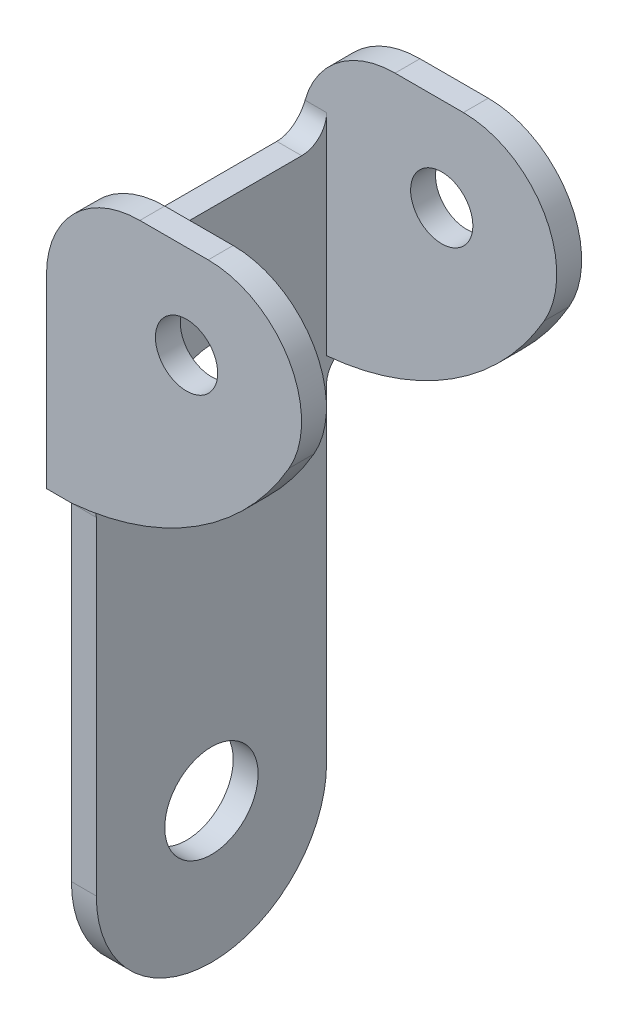
from build123d import *

# Parameters (mm, degrees)
SKETCH_1_R          = 1
EXTRUDE_1_DEPTH     = 9
SKETCH_2_W          = 7.4
SKETCH_2_H          = 10
CUT_EXTRUDE_1_DEPTH = 9
SKETCH_3_W          = 0.8
SKETCH_3_H          = 15.035626068
CUT_EXTRUDE_2_DEPTH = 9
FILLET_2_R          = 3.7
SKETCH_4_W          = 7.4
SKETCH_4_H          = 2.039607805
CUT_EXTRUDE_3_DEPTH = 9
SKETCH_5_R          = 1.5
CUT_EXTRUDE_4_DEPTH = 9
FILLET_3_R          = 0.8


# Some blends are built 0.0001 mm under size
with BuildPart() as part:
    # 草图1 → 凸台-拉伸1 (new body)
    with BuildSketch(Plane.XY):
        with BuildLine():
            Line((3, 0), (5.196152423, 0))
            ThreePointArc((5.196152423, 0), (7.794228634, -1.5), (7.794228634, -4.5))
            ThreePointArc((7.794228634, -4.5), (4.842298019, -7.586313327), (0.8, -8.964373932))
            Line((0.8, -8.964373932), (0.8, -24))
            Line((0.8, -24), (0, -24))
            Line((0, -24), (0, -3))
            ThreePointArc((0, -3), (0.878679656, -0.878679656), (3, 0))
        make_face()
        with Locations((4.5, -3)):
            Circle(SKETCH_1_R, mode=Mode.SUBTRACT)
    extrude(amount=EXTRUDE_1_DEPTH)

    # 草图2 → 切除-拉伸1 (cut)
    with BuildSketch(Plane(origin=(0.8, 0, 0), x_dir=(0, 0, -1), z_dir=(1, 0, 0))):
        with Locations((-4.5, -3.964373932)):
            Rectangle(SKETCH_2_W, SKETCH_2_H)
    extrude(amount=CUT_EXTRUDE_1_DEPTH, mode=Mode.SUBTRACT)

    # 草图3 → 切除-拉伸2 (cut)
    with BuildSketch(Plane(origin=(0.8, 0, 0), x_dir=(0, 0, -1), z_dir=(1, 0, 0))):
        with Locations((-8.6, -16.482186966)):
            Rectangle(SKETCH_3_W, SKETCH_3_H)
        with Locations((-0.4, -16.482186966)):
            Rectangle(SKETCH_3_W, SKETCH_3_H)
    extrude(amount=-CUT_EXTRUDE_2_DEPTH, mode=Mode.SUBTRACT)

    # 圆角2
    fillet_2_edges = [part.edges().sort_by_distance(p)[0] for p in [
        (0.4, -24, 0.8),
        (0.4, -24, 8.2),
    ]]
    fillet(fillet_2_edges, radius=FILLET_2_R - 0.0001)  # a hair under: the kernel refuses the full size

    # 草图4 → 切除-拉伸3 (cut)
    with BuildSketch(Plane.ZY):
        with Locations((4.5, -1.980196097)):
            Rectangle(SKETCH_4_W, SKETCH_4_H)
    extrude(amount=-CUT_EXTRUDE_3_DEPTH, mode=Mode.SUBTRACT)

    # 草图5 → 切除-拉伸4 (cut)
    with BuildSketch(Plane(origin=(0.8, 0, 0), x_dir=(0, 0, -1), z_dir=(1, 0, 0))):
        with Locations(Location((-4.5, -8.3, 0), (0, 0, 90))):
            Circle(SKETCH_5_R)
        with Locations(Location((-4.5, -19.5, 0), (0, 0, 90))):
            Circle(SKETCH_5_R)
    extrude(amount=-CUT_EXTRUDE_4_DEPTH, mode=Mode.SUBTRACT)

    # 圆角3
    # the kernel refuses this fillet: 0.8 mm, written as the material it adds along each edge
    with BuildSketch(Plane(origin=(0.8, -8.964373932, 0.8), x_dir=(0, -1, 0), z_dir=(-1, 0, 0))) as fillet_3_piece_1:
        with BuildLine():
            CenterArc((FILLET_3_R, -FILLET_3_R), FILLET_3_R, 90, 90)
            Line((0, -FILLET_3_R), (0, 0))
            Line((0, 0), (FILLET_3_R, 0))
        make_face()
    extrude(amount=0.8)
    with BuildSketch(Plane(origin=(0.8, -8.964373932, 8.2), x_dir=(0, -1, 0), z_dir=(-1, 0, 0))) as fillet_3_piece_2:
        with BuildLine():
            CenterArc((FILLET_3_R, FILLET_3_R), FILLET_3_R, 180, 90)
            Line((0, FILLET_3_R), (0, 0))
            Line((0, 0), (FILLET_3_R, 0))
        make_face()
    extrude(amount=0.8)
    with BuildSketch(Plane(origin=(-2, -3, 0.8), x_dir=(0, 0, 1), z_dir=(1, 0, 0))) as fillet_3_piece_3_section:
        with BuildLine():
            CenterArc((FILLET_3_R, -FILLET_3_R), FILLET_3_R, 90, 90)
            Line((0, -FILLET_3_R), (0, 0))
            Line((0, 0), (FILLET_3_R, 0))
        make_face()
    fillet_3_piece_3 = extrude(amount=2.8, mode=Mode.PRIVATE)
    fillet_3_piece_3 = fillet_3_piece_3 & Plane(origin=(3, -3, 0.979954946), x_dir=(-1, 0, 0), z_dir=(0, 0, -1)) * Cylinder(3, 9, mode=Mode.PRIVATE)
    add(fillet_3_piece_3)
    with BuildSketch(Plane(origin=(-2, -3, 8.2), x_dir=(0, 0, -1), z_dir=(1, 0, 0))) as fillet_3_piece_4_section:
        with BuildLine():
            CenterArc((FILLET_3_R, FILLET_3_R), FILLET_3_R, 180, 90)
            Line((0, FILLET_3_R), (0, 0))
            Line((0, 0), (FILLET_3_R, 0))
        make_face()
    fillet_3_piece_4 = extrude(amount=2.8, mode=Mode.PRIVATE)
    fillet_3_piece_4 = fillet_3_piece_4 & Plane(origin=(3, -3, 8.020045054), x_dir=(-1, 0, 0), z_dir=(0, 0, -1)) * Cylinder(3, 9, mode=Mode.PRIVATE)
    add(fillet_3_piece_4)


solid = part.part
